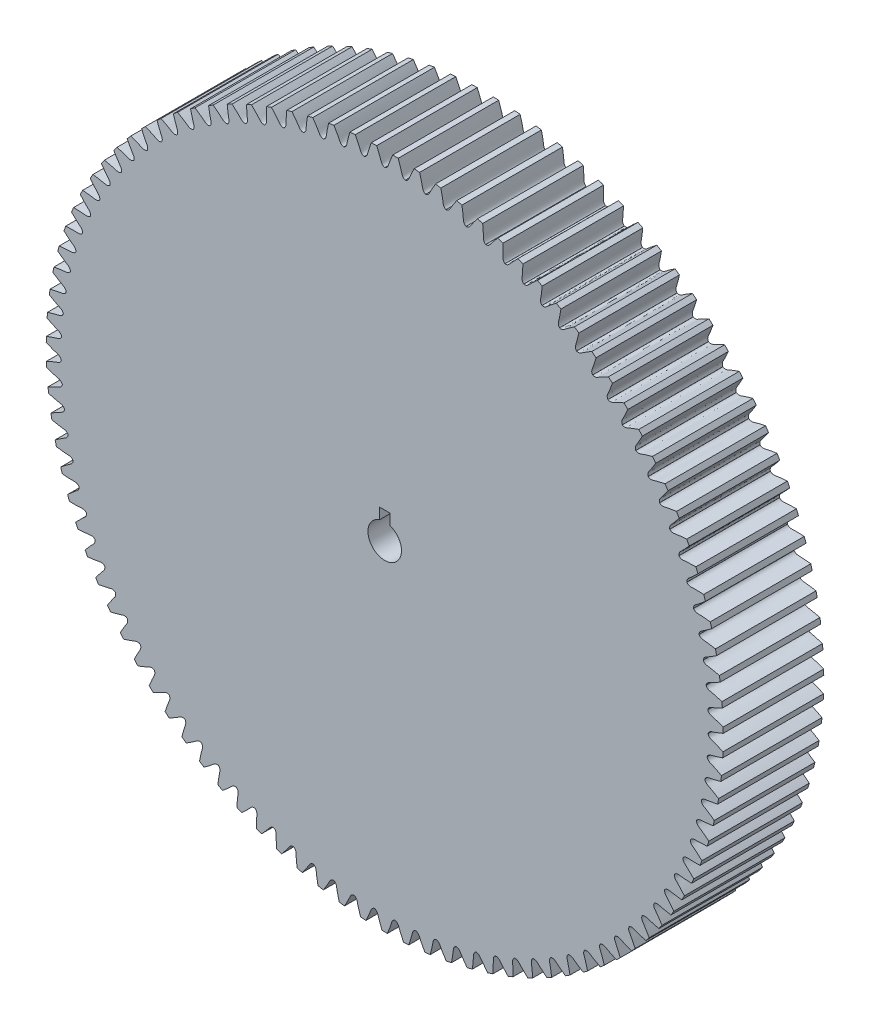
from build123d import *

# Parameters (mm, degrees)
SKETCH_1_R               = 101
EXTRUDE_1_DEPTH          = 30
CUT_EXTRUDE_1_DEPTH      = 146.95204692
PATTERN_CIRCULAR_1_COUNT = 99
CUT_EXTRUDE_2_DEPTH      = 146.949877991


with BuildPart() as part:
    # 草图1 → 凸台-拉伸1 (new body)
    with BuildSketch(Plane.XY):
        Circle(SKETCH_1_R)
    extrude(amount=EXTRUDE_1_DEPTH)

    # 草图2 → 切除-拉伸1 (cut, through all)
    with BuildSketch(Plane.XY):
        with BuildLine():
            ThreePointArc((0.01, 96.497735208), (0, 96.497735726), (-0.01, 96.497735208))
            add(Edge.make_bspline(
                [(-0.01, 96.497735208), (-0.880702213, 96.765283415), (-1.081729266, 97.682137245), (-1.480335897, 98.75021349), (-1.723249114, 99.386818134), (-1.994967804, 100.051620904), (-2.294055568, 100.745401348), (-2.622543554, 101.46682719), (-2.981428967, 102.215127809), (-3.371975521, 102.989321878), (-3.795337432, 103.788440707), (-4.252666101, 104.611464954), (-4.745078301, 105.457343611), (-5.27366401, 106.324989495), (-5.839482955, 107.213281465), (-6.443564389, 108.121064762), (-7.086905984, 109.047151904), (-7.770472964, 109.990323466), (-8.495197318, 110.949328905), (-9.261976557, 111.922887421), (-10.357310698, 113.257801749), (-11.221252412, 114.247711631), (-11.818135527, 114.905385533)],
                knots=[0, 0, 0, 0, 0.095311067, 0.124511636, 0.15539998, 0.187976102, 0.22224, 0.258191675, 0.295831127, 0.335158355, 0.37617336, 0.418876142, 0.4632667, 0.509345035, 0.557111147, 0.606565035, 0.6577067, 0.710536142, 0.76505336, 0.821258355, 0.879151127, 1, 1, 1, 1], degree=3))
            ThreePointArc((-11.818135527, 114.905385533), (0, 115.511540341), (11.818135527, 114.905385533))
            add(Edge.make_bspline(
                [(0.01, 96.497735208), (0.880702213, 96.765283415), (1.081729266, 97.682137245), (1.480335897, 98.75021349), (1.723249114, 99.386818134), (1.994967804, 100.051620904), (2.294055568, 100.745401348), (2.622543554, 101.46682719), (2.981428967, 102.215127809), (3.371975521, 102.989321878), (3.795337432, 103.788440707), (4.252666101, 104.611464954), (4.745078301, 105.457343611), (5.27366401, 106.324989495), (5.839482955, 107.213281465), (6.443564389, 108.121064762), (7.086905984, 109.047151904), (7.770472964, 109.990323466), (8.495197318, 110.949328905), (9.261976557, 111.922887421), (10.357310698, 113.257801749), (11.221252412, 114.247711631), (11.818135527, 114.905385533)],
                knots=[0, 0, 0, 0, 0.095311067, 0.124511636, 0.15539998, 0.187976102, 0.22224, 0.258191675, 0.295831127, 0.335158355, 0.37617336, 0.418876142, 0.4632667, 0.509345035, 0.557111147, 0.606565035, 0.6577067, 0.710536142, 0.76505336, 0.821258355, 0.879151127, 1, 1, 1, 1], degree=3))
        make_face()
    cut_extrude_1 = extrude(amount=CUT_EXTRUDE_1_DEPTH, mode=Mode.SUBTRACT)

    # 阵列(圆周)1: 切除-拉伸1 ×99 about axis
    pattern_circular_1_axis = Axis((0, 0, -1.5), (0, 0, 1))
    for i in range(1, PATTERN_CIRCULAR_1_COUNT):
        add(cut_extrude_1.rotate(pattern_circular_1_axis, i * 360 / PATTERN_CIRCULAR_1_COUNT), mode=Mode.SUBTRACT)

    # 草图4 → 切除-拉伸2 (cut, through all)
    with BuildSketch(Plane.XY.offset(30)):
        with BuildLine():
            Line((1.5, 4.769696007), (1.5, 8))
            Line((1.5, 8), (-1.5, 8))
            Line((-1.5, 8), (-1.5, 4.769696007))
            ThreePointArc((-1.5, 4.769696007), (0, -5), (1.5, 4.769696007))
        make_face()
    extrude(amount=-CUT_EXTRUDE_2_DEPTH, mode=Mode.SUBTRACT)


solid = part.part
